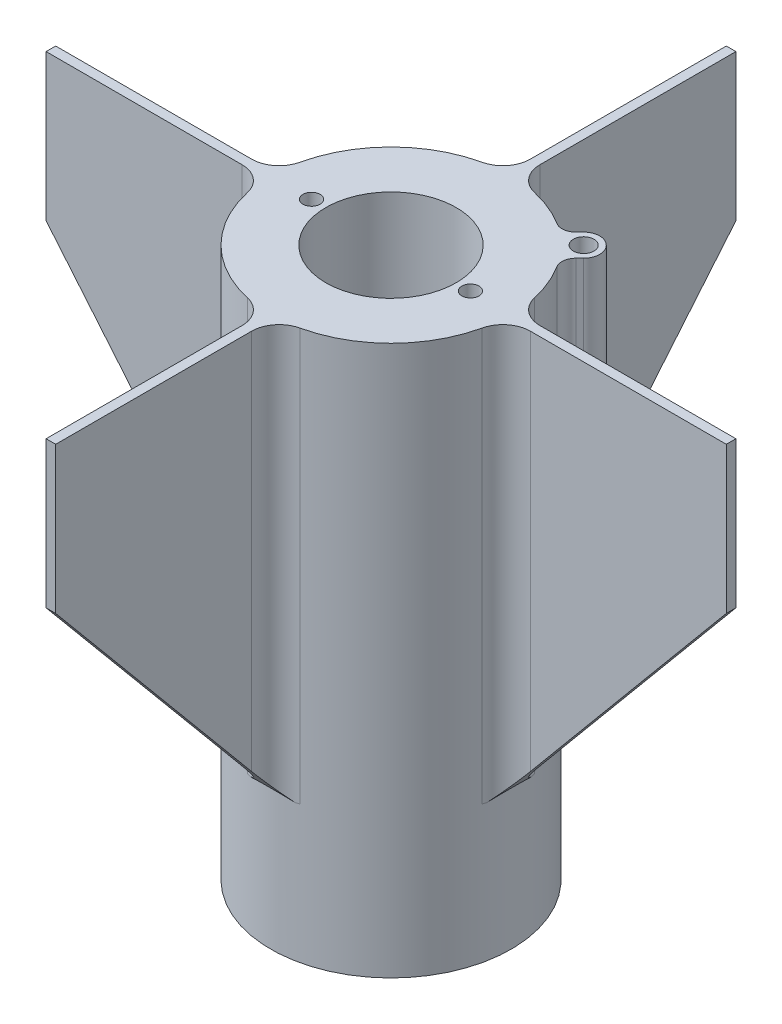
from build123d import *
from build123d.topology import SkipClean

# Parameters (mm, degrees)
SKETCH1_R             = 22.225
SKETCH1_R_2           = 12.05
BOSS_EXTRUDE1_DEPTH   = 63.5
SKETCH2_R             = 11.9
BOSS_EXTRUDE2_DEPTH   = 69.85
BOSS_EXTRUDE3_START   = -2.032
SKETCH5_R             = 22.225
SKETCH5_R_2           = 12.05
BOSS_EXTRUDE3_DEPTH   = 2.032
SKETCH6_R             = 1.5875
BOSS_EXTRUDE4_DEPTH   = 19.05
SKETCH6_2_R           = 1.5875
CUT_EXTRUDE8_DEPTH    = 19.05
BOSS_EXTRUDE5_START   = -76.2
BOSS_EXTRUDE5_DEPTH   = 76.2
CUT_EXTRUDE9_DEPTH    = 97.774416666
BOSS_EXTRUDE6_DEPTH   = 15.875
BOSS_EXTRUDE6_2_DEPTH = 15.875
BOSS_EXTRUDE7_START   = 38.1
SKETCH11_R            = 22.225
SKETCH11_R_2          = 21.175
BOSS_EXTRUDE7_DEPTH   = 38.1
CIRPATTERN2_COUNT     = 4
CIRPATTERN2_2_COUNT   = 4
SKETCH24_R            = 1.905
BOSS_EXTRUDE13_DEPTH  = 50.8
FILLET1_R             = 2.54
CUT_REVOLVE1_ANGLE    = 25.63963
CUT_EXTRUDE10_START   = -4.57171
SKETCH28_R            = 3.175
CUT_EXTRUDE10_DEPTH   = 26.1828


# Read off the part's stored shape, not the designer's step: Cut-Revolve1
with BuildPart() as part:
    # Sketch1 → Boss-Extrude1 (new body)
    with BuildSketch(Plane(origin=(0, 0, 0), x_dir=(1, 0, 0), z_dir=(0, 1, 0))):
        with Locations(Location((0, 0, 0), (0, 0, 270))):
            Circle(SKETCH1_R)
        with Locations(Location((0, 0, 0), (0, 0, 270))):
            Circle(SKETCH1_R_2, mode=Mode.SUBTRACT)
        with BuildLine():
            Line((0.5207, 13.081040688), (0.5207, 21.168596942))
            ThreePointArc((0.5207, 21.168596942), (14.972986092, 14.972986092), (21.168596942, 0.5207))
            Line((21.168596942, 0.5207), (13.081040688, 0.5207))
            ThreePointArc((13.081040688, 0.5207), (9.257017715, 9.257017715), (0.5207, 13.081040688))
        make_face(mode=Mode.SUBTRACT)
        with BuildLine():
            Line((-0.5207, 13.081040688), (-0.5207, 21.168596942))
            ThreePointArc((-0.5207, 21.168596942), (-14.972986092, 14.972986092), (-21.168596942, 0.5207))
            Line((-21.168596942, 0.5207), (-13.081040688, 0.5207))
            ThreePointArc((-13.081040688, 0.5207), (-9.257017715, 9.257017715), (-0.5207, 13.081040688))
        make_face(mode=Mode.SUBTRACT)
        with BuildLine():
            Line((13.081040688, -0.5207), (21.168596942, -0.5207))
            ThreePointArc((21.168596942, -0.5207), (14.972986092, -14.972986092), (0.5207, -21.168596942))
            Line((0.5207, -21.168596942), (0.5207, -13.081040688))
            ThreePointArc((0.5207, -13.081040688), (9.257017715, -9.257017715), (13.081040688, -0.5207))
        make_face(mode=Mode.SUBTRACT)
        with BuildLine():
            Line((-0.5207, -13.081040688), (-0.5207, -21.168596942))
            ThreePointArc((-0.5207, -21.168596942), (-14.972986092, -14.972986092), (-21.168596942, -0.5207))
            Line((-21.168596942, -0.5207), (-13.081040688, -0.5207))
            ThreePointArc((-13.081040688, -0.5207), (-9.257017715, -9.257017715), (-0.5207, -13.081040688))
        make_face(mode=Mode.SUBTRACT)
    extrude(amount=BOSS_EXTRUDE1_DEPTH)

    # Sketch5 → Boss-Extrude3 (add)
    with BuildSketch(Plane(origin=(0, 63.5, 0), x_dir=(1, 0, 0), z_dir=(0, 1, 0)).offset(BOSS_EXTRUDE3_START)):
        with Locations(Location((0, 0, 0), (0, 0, 270))):
            Circle(SKETCH5_R)
        with Locations(Location((0, 0, 0), (0, 0, 270))):
            Circle(SKETCH5_R_2, mode=Mode.SUBTRACT)
    extrude(amount=BOSS_EXTRUDE3_DEPTH)

    # Sketch6 → Boss-Extrude4 (add)
    # profile 1 of 2: a face of its own
    with BuildSketch(Plane(origin=(0, 63.5, 0), x_dir=(1, 0, 0), z_dir=(0, 1, 0))):
        with BuildLine():
            Line((12.847469051, 2.515411086), (12.847469051, -2.515411086))
            ThreePointArc((12.847469051, -2.515411086), (17.7904, 0), (12.847469051, 2.515411086))
        make_face()
        with Locations((14.6789, 0)):
            Circle(SKETCH6_R, mode=Mode.SUBTRACT)
    # profile 2 of 2: a face of its own
    with BuildSketch(Plane(origin=(0, 63.5, 0), x_dir=(1, 0, 0), z_dir=(0, 1, 0))):
        with BuildLine():
            Line((-12.847469051, 2.515411086), (-12.847469051, -2.515411086))
            ThreePointArc((-12.847469051, -2.515411086), (-17.7904, 0), (-12.847469051, 2.515411086))
        make_face()
        with Locations((-14.6789, 0)):
            Circle(SKETCH6_R, mode=Mode.SUBTRACT)
    extrude(amount=-BOSS_EXTRUDE4_DEPTH)

    # Sketch6<2> → Cut-Extrude8 (cut)
    with BuildSketch(Plane(origin=(0, 63.5, 0), x_dir=(1, 0, 0), z_dir=(0, 1, 0))):
        with Locations(Location((-14.6789, 0, 0), (0, 0, 270))):
            Circle(SKETCH6_2_R)
        with Locations(Location((14.6789, 0, 0), (0, 0, 270))):
            Circle(SKETCH6_2_R)
    extrude(amount=-CUT_EXTRUDE8_DEPTH, mode=Mode.SUBTRACT)

    # Sketch8 → Boss-Extrude5 (add)
    with BuildSketch(Plane(origin=(0, 63.5, 0), x_dir=(1, 0, 0), z_dir=(0, 1, 0)).offset(BOSS_EXTRUDE5_START)):
        with BuildLine():
            Line((26.644587893, -0.889), (62.865, -0.889))
            Line((62.865, -0.889), (62.865, 0.889))
            Line((62.865, 0.889), (26.644587893, 0.889))
            ThreePointArc((26.644587893, 0.889), (23.469292558, 2.003662746), (21.687455262, 4.858488372))
            ThreePointArc((21.687455262, 4.858488372), (22.225, 0), (21.687455262, -4.858488372))
            ThreePointArc((21.687455262, -4.858488372), (23.469292558, -2.003662746), (26.644587893, -0.889))
        make_face()
    boss_extrude5 = extrude(amount=BOSS_EXTRUDE5_DEPTH)

    # Sketch9 → Cut-Extrude9 (cut, symmetric)
    with BuildSketch(Plane(origin=(0, 0, -0.889), x_dir=(-1, 0, 0), z_dir=(0, 0, -1))):
        Polygon((-21.887063983, -12.7), (-62.865, 36.422254278), (-62.865, -12.7), align=None)
    cut_extrude9 = extrude(amount=CUT_EXTRUDE9_DEPTH, both=True, mode=Mode.SUBTRACT)

    # CirPattern2: Boss-Extrude5 ×4 about axis
    cirpattern2_axis = Axis((0, 0, 0), (0, 1, 0))
    for i in range(1, CIRPATTERN2_COUNT):
        add(boss_extrude5.rotate(cirpattern2_axis, i * 360 / CIRPATTERN2_COUNT))

    # CirPattern2 2: Cut-Extrude9 ×4 about axis
    cirpattern2_2_axis = Axis((0, 0, 0), (0, 1, 0))
    for i in range(1, CIRPATTERN2_2_COUNT):
        add(cut_extrude9.rotate(cirpattern2_2_axis, i * 360 / CIRPATTERN2_2_COUNT), mode=Mode.SUBTRACT)


with BuildPart() as body_2:
    # Sketch2 → Boss-Extrude2 (new body)
    with BuildSketch(Plane.XZ):
        with Locations(Location((0, 0, 0), (0, 0, 270))):
            Circle(SKETCH2_R)
    extrude(amount=-BOSS_EXTRUDE2_DEPTH)


with BuildPart() as body_3:
    # Sketch10 → Boss-Extrude6 (new body)
    with BuildSketch(Plane.XZ):
        with BuildLine():
            Line((8.519690028, 9.939800591), (8.519690028, -9.939800591))
            ThreePointArc((8.519690028, -9.939800591), (13.0914, 0), (8.519690028, 9.939800591))
        make_face()
    extrude(amount=BOSS_EXTRUDE6_DEPTH)


with BuildPart() as body_4:
    # Sketch10 → Boss-Extrude6 2 (new body)
    with BuildSketch(Plane.XZ):
        with BuildLine():
            Line((-8.519690028, 9.939800591), (-8.519690028, -9.939800591))
            ThreePointArc((-8.519690028, -9.939800591), (-13.0914, 0), (-8.519690028, 9.939800591))
        make_face()
    extrude(amount=BOSS_EXTRUDE6_2_DEPTH)

    # Combine3: union body 3, part
    add(body_3.part)
    add(part.part)


with BuildPart() as body_5:
    # Sketch11 → Boss-Extrude7 (new body)
    with BuildSketch(Plane.XZ.offset(BOSS_EXTRUDE7_START)):
        with Locations(Location((0, 0, 0), (0, 0, 90))):
            Circle(SKETCH11_R)
        with Locations(Location((0, 0, 0), (0, 0, 90))):
            Circle(SKETCH11_R_2, mode=Mode.SUBTRACT)
    extrude(amount=-BOSS_EXTRUDE7_DEPTH)

    # Combine4: union body 4
    add(body_4.part)

    # Sketch24 → Boss-Extrude13 (add)
    with SkipClean():  # the faces are left unmerged after this step: merging them gives an invalid solid
        with BuildSketch(Plane(origin=(0, 63.5, 0), x_dir=(1, 0, 0), z_dir=(0, 1, 0))):
            with BuildLine():
                Line((15.715448212, 19.894449289), (13.48641998, 17.665421057))
                ThreePointArc((13.48641998, 17.665421057), (15.715448212, 15.715448212), (17.665421057, 13.48641998))
                Line((17.665421057, 13.48641998), (19.894449289, 15.715448212))
                ThreePointArc((19.894449289, 15.715448212), (19.894449289, 19.894449289), (15.715448212, 19.894449289))
            make_face()
            with Locations(Location((17.80494875, 17.80494875, 0), (0, 0, 270))):
                Circle(SKETCH24_R, mode=Mode.SUBTRACT)
        extrude(amount=-BOSS_EXTRUDE13_DEPTH)

    # Fillet1
    # the kernel refuses this fillet: 2.54 mm, written as the material it adds along each edge
    with BuildSketch(Plane(origin=(17.665421057, 63.5, -13.48641998), x_dir=(0.5702807097884078, 0, 0.8214498840728082), z_dir=(0, -1, 0))) as fillet1_piece_1:
        with BuildLine():
            CenterArc((2.123100743, -2.537406084), FILLET1_R, 92.589617746, 77.180185074)
            Line((-0.376518694, -2.086293381), (0, 0))
            ThreePointArc((0, 0), (1.00416927, -0.022696762), (2.00833854, 0))
        make_face()
    extrude(amount=50.8)
    with BuildSketch(Plane(origin=(13.48641998, 63.5, -17.665421057), x_dir=(-0.8214498840728011, 0, -0.5702807097884178), z_dir=(0, -1, 0))) as fillet1_piece_2:
        with BuildLine():
            CenterArc((2.123100743, 2.537406084), FILLET1_R, 190.23019718, 77.180185074)
            Line((-0.376518694, 2.086293381), (0, 0))
            ThreePointArc((0, 0), (1.00416927, 0.022696762), (2.00833854, 0))
        make_face()
    extrude(amount=50.8)

    # Cut-Revolve1 outline → Cut-Revolve1 (revolve, cut)
    with BuildSketch(Plane(origin=(0, 0, 0), x_dir=(0.8463774031608068, 0, -0.5325836004035134), z_dir=(0.5325836004035134, 0, 0.8463774031608068))):
        Polygon((28.135, 22.936420272), (22.224995946, 12.699992978), (28.135, 12.7), align=None)
    revolve(axis=Axis((0, 0, 0), (0, 1, 0)), revolution_arc=CUT_REVOLVE1_ANGLE, mode=Mode.SUBTRACT)

    # Sketch28 → Cut-Extrude10 (cut)
    with BuildSketch(Plane(origin=(-8.519690028, 0, 0), x_dir=(0, 0, -1), z_dir=(1, 0, 0)).offset(CUT_EXTRUDE10_START)):
        with BuildLine():
            ThreePointArc((0, -15.875), (-6.485796847, -13.515677214), (-9.939800591, -7.540576974))
            Line((-9.939800591, -7.540576974), (-9.939800591, -15.875))
            Line((-9.939800591, -15.875), (0, -15.875))
        make_face()
        with BuildLine():
            ThreePointArc((9.939800591, -7.540576974), (6.485796847, -13.515677214), (0, -15.875))
            Line((0, -15.875), (9.939800591, -15.875))
            Line((9.939800591, -15.875), (9.939800591, -7.540576974))
        make_face()
        with Locations((0, -5.780585399)):
            Circle(SKETCH28_R)
    extrude(amount=CUT_EXTRUDE10_DEPTH, mode=Mode.SUBTRACT)


solid = body_5.part
